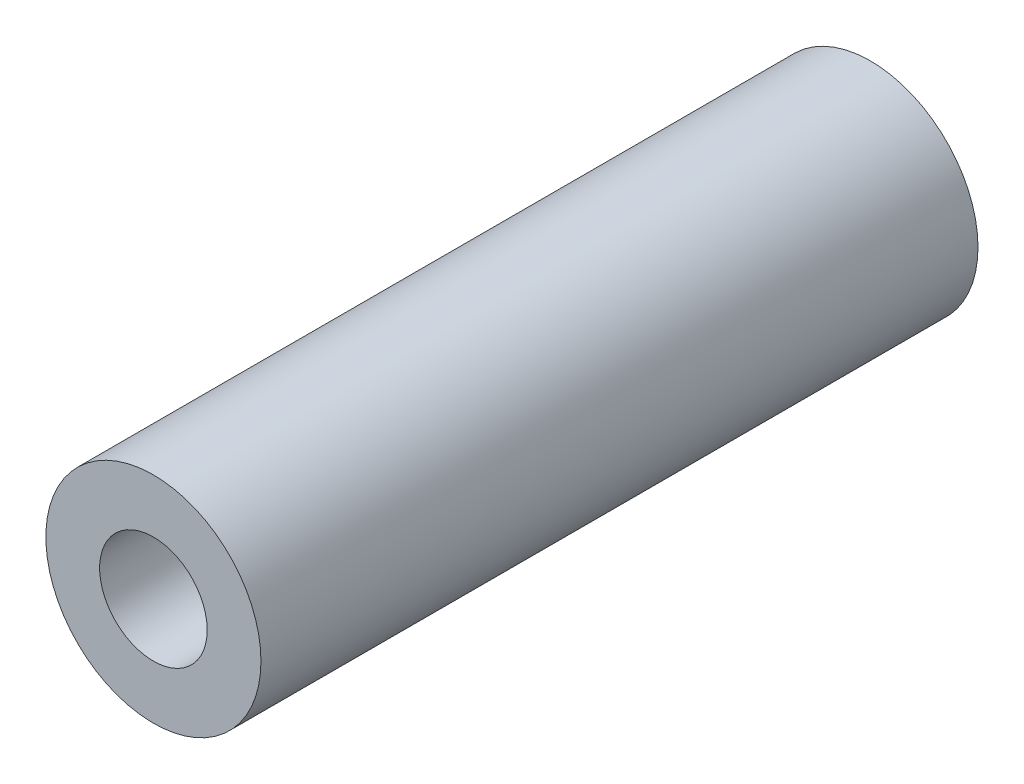
from build123d import *

# Parameters (mm, degrees)
SKETCH_1_R      = 3
SKETCH_1_R_2    = 1.5
EXTRUDE_1_DEPTH = 20


with BuildPart() as part:
    # ｽｹｯﾁ1 → ﾎﾞｽ - 押し出し1 (new body)
    with BuildSketch(Plane.XY):
        Circle(SKETCH_1_R)
        Circle(SKETCH_1_R_2, mode=Mode.SUBTRACT)
    extrude(amount=EXTRUDE_1_DEPTH)


solid = part.part
